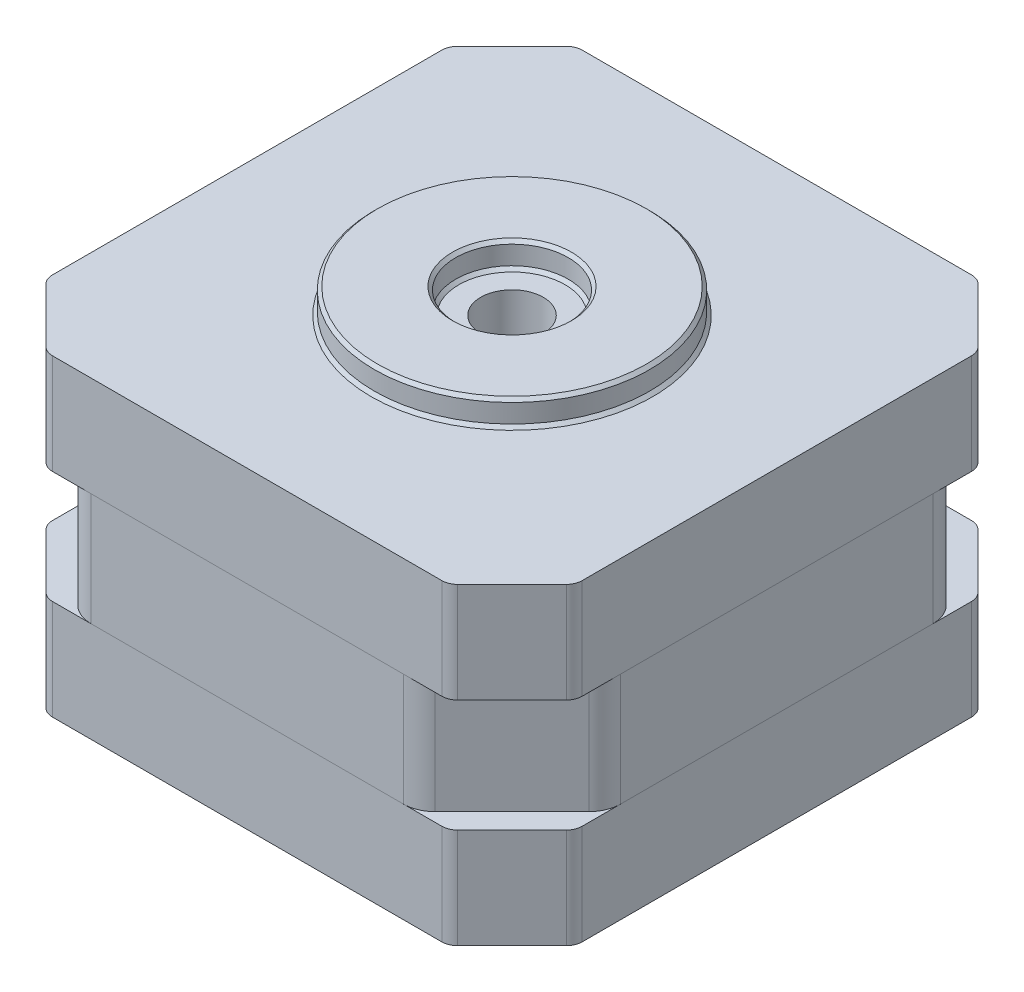
from build123d import *

# Parameters (mm, degrees)
SKETCH1_W           = 42.3
SKETCH1_H           = 42.3
BOSS_EXTRUDE1_DEPTH = 8.001
CHAMFER1_SIZE       = 5.08
SKETCH2_W           = 42.3
SKETCH2_H           = 42.3
BOSS_EXTRUDE2_DEPTH = 8.9916
CHAMFER3_SIZE       = 7.62
FILLET1_R           = 2.54
FILLET2_R           = 1.27
SKETCH3_W           = 42.3
SKETCH3_H           = 42.3
BOSS_EXTRUDE3_DEPTH = 8.001
CHAMFER4_SIZE       = 5.08
FILLET3_R           = 1.27
SKETCH4_R           = 10.9982
SKETCH4_R_2         = 4.4958
BOSS_EXTRUDE4_DEPTH = 2
CHAMFER5_SIZE       = 0.254
SKETCH5_R           = 2.5019
CUT_EXTRUDE1_DEPTH  = 39.978520251


with BuildPart() as part:
    # Sketch1 → Boss-Extrude1 (new body)
    with BuildSketch(Plane(origin=(0, 0, 0), x_dir=(1, 0, 0), z_dir=(0, 1, 0))):
        Rectangle(SKETCH1_W, SKETCH1_H)
    extrude(amount=BOSS_EXTRUDE1_DEPTH)

    # Chamfer1
    chamfer1_edges = [part.edges().sort_by_distance(p)[0] for p in [
        (-21.15, 4.0005, 21.15),
        (-21.15, 4.0005, -21.15),
        (21.15, 4.0005, -21.15),
        (21.15, 4.0005, 21.15),
    ]]
    chamfer(chamfer1_edges, length=CHAMFER1_SIZE)

    # Fillet2
    fillet2_edges = [part.edges().sort_by_distance(p)[0] for p in [
        (-21.15, 4.0005, -16.07),
        (-16.07, 4.0005, -21.15),
        (16.07, 4.0005, -21.15),
        (21.15, 4.0005, -16.07),
        (21.15, 4.0005, 16.07),
        (16.07, 4.0005, 21.15),
        (-16.07, 4.0005, 21.15),
        (-21.15, 4.0005, 16.07),
    ]]
    fillet(fillet2_edges, radius=FILLET2_R)


with BuildPart() as body_2:
    # Sketch2 → Boss-Extrude2 (new body)
    with BuildSketch(Plane(origin=(0, 8.001, 0), x_dir=(1, 0, 0), z_dir=(0, 1, 0))):
        Rectangle(SKETCH2_W, SKETCH2_H)
    extrude(amount=BOSS_EXTRUDE2_DEPTH)

    # Chamfer3
    chamfer3_edges = [body_2.edges().sort_by_distance(p)[0] for p in [
        (-21.15, 12.4968, -21.15),
        (-21.15, 12.4968, 21.15),
        (21.15, 12.4968, 21.15),
        (21.15, 12.4968, -21.15),
    ]]
    chamfer(chamfer3_edges, length=CHAMFER3_SIZE)

    # Fillet1
    fillet1_edges = [body_2.edges().sort_by_distance(p)[0] for p in [
        (-21.15, 12.4968, -13.53),
        (-13.53, 12.4968, -21.15),
        (13.53, 12.4968, -21.15),
        (21.15, 12.4968, -13.53),
        (21.15, 12.4968, 13.53),
        (13.53, 12.4968, 21.15),
        (-13.53, 12.4968, 21.15),
        (-21.15, 12.4968, 13.53),
    ]]
    fillet(fillet1_edges, radius=FILLET1_R)


with BuildPart() as body_3:
    # Sketch3 → Boss-Extrude3 (new body)
    with BuildSketch(Plane(origin=(0, 16.9926, 0), x_dir=(1, 0, 0), z_dir=(0, 1, 0))):
        Rectangle(SKETCH3_W, SKETCH3_H)
    extrude(amount=BOSS_EXTRUDE3_DEPTH)

    # Chamfer4
    chamfer4_edges = [body_3.edges().sort_by_distance(p)[0] for p in [
        (-21.15, 20.9931, 21.15),
        (-21.15, 20.9931, -21.15),
        (21.15, 20.9931, -21.15),
        (21.15, 20.9931, 21.15),
    ]]
    chamfer(chamfer4_edges, length=CHAMFER4_SIZE)

    # Fillet3
    fillet3_edges = [body_3.edges().sort_by_distance(p)[0] for p in [
        (-21.15, 20.9931, -16.07),
        (-16.07, 20.9931, -21.15),
        (16.07, 20.9931, -21.15),
        (21.15, 20.9931, -16.07),
        (21.15, 20.9931, 16.07),
        (16.07, 20.9931, 21.15),
        (-16.07, 20.9931, 21.15),
        (-21.15, 20.9931, 16.07),
    ]]
    fillet(fillet3_edges, radius=FILLET3_R)

    # Sketch4 → Boss-Extrude4 (add)
    with BuildSketch(Plane(origin=(0, 24.9936, 0), x_dir=(1, 0, 0), z_dir=(0, 1, 0))):
        Circle(SKETCH4_R)
        Circle(SKETCH4_R_2, mode=Mode.SUBTRACT)
    extrude(amount=BOSS_EXTRUDE4_DEPTH)

    # Chamfer5
    chamfer5_edges = [body_3.edges().sort_by_distance(p)[0] for p in [
        (-10.9982, 26.9936, 0),
        (-10.9982, 24.9936, 0),
        (-4.4958, 24.9936, 0),
        (-4.4958, 26.9936, 0),
    ]]
    chamfer(chamfer5_edges, length=CHAMFER5_SIZE)


with BuildPart() as cut_extrude1_tool:
    # Sketch5 → Cut-Extrude1 (new, through all)
    with BuildSketch(Plane(origin=(0, 24.9936, 0), x_dir=(1, 0, 0), z_dir=(0, 1, 0))):
        Circle(SKETCH5_R)
    extrude(amount=-CUT_EXTRUDE1_DEPTH)


with BuildPart() as part_1:
    add(part.part)

    # Cut-Extrude1: cut by cut_extrude1_tool
    add(cut_extrude1_tool.part, mode=Mode.SUBTRACT)


with BuildPart() as body_2_1:
    add(body_2.part)

    # Cut-Extrude1: cut by cut_extrude1_tool
    add(cut_extrude1_tool.part, mode=Mode.SUBTRACT)


with BuildPart() as body_3_1:
    add(body_3.part)

    # Cut-Extrude1: cut by cut_extrude1_tool
    add(cut_extrude1_tool.part, mode=Mode.SUBTRACT)


solid = Compound([part_1.part, body_2_1.part, body_3_1.part])
